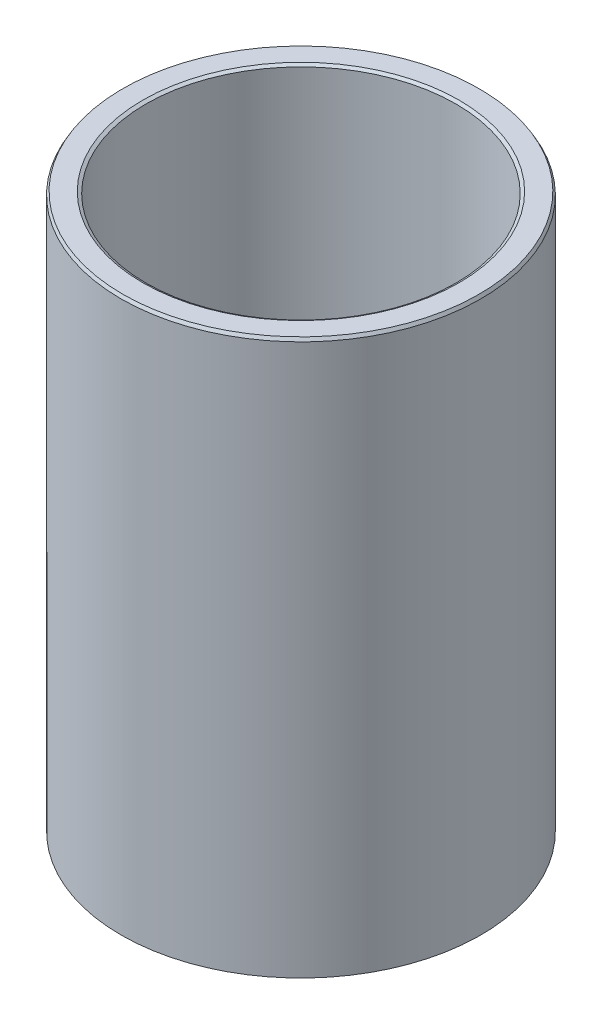
from build123d import *
from OCP.BRepFilletAPI import BRepFilletAPI_MakeChamfer

# Parameters (mm, degrees)
SKETCH1_R           = 42.5
BOSS_EXTRUDE1_DEPTH = 131.298463846
SKETCH2_R           = 36.633423213
CUT_EXTRUDE1_DEPTH  = 145.401477168
CHAMFER1_SIZE       = 0.730698724
CHAMFER1_SIZE2      = 0.421869105


with BuildPart() as part:
    # Sketch1 → Boss-Extrude1 (new body)
    with BuildSketch(Plane(origin=(0, 0, 0), x_dir=(1, 0, 0), z_dir=(0, 1, 0))):
        Circle(SKETCH1_R)
    extrude(amount=BOSS_EXTRUDE1_DEPTH)

    # Sketch2 → Cut-Extrude1 (cut, through all)
    with BuildSketch(Plane(origin=(0, 0, 0), x_dir=(1, 0, 0), z_dir=(0, 1, 0))):
        Circle(SKETCH2_R)
    extrude(amount=CUT_EXTRUDE1_DEPTH, mode=Mode.SUBTRACT)

    # Chamfer1: one chamfer whose edges measure the first distance from different faces: ONE call of the kernel's chamfer builder (chamfer() names one face for all edges)
    chamfer1_edges_1 = [part.edges().sort_by_distance(p)[0] for p in [
        (-36.633423213, 131.298463846, 0),
    ]]
    chamfer1_side_1 = [part.faces().sort_by_distance(p)[0] for p in [
        (-41.297918472, 131.298463846, 0),
    ]]
    chamfer1_edges_2 = [part.edges().sort_by_distance(p)[0] for p in [
        (-36.633423213, 0, 0),
    ]]
    chamfer1_side_2 = [part.faces().sort_by_distance(p)[0] for p in [
        (-36.633423213, 65.649231923, 0),
    ]]
    chamfer1_edges_3 = [part.edges().sort_by_distance(p)[0] for p in [
        (-42.5, 0, 0),
    ]]
    chamfer1_side_3 = [part.faces().sort_by_distance(p)[0] for p in [
        (-41.297918472, 0, 0),
    ]]
    chamfer1_edges_4 = [part.edges().sort_by_distance(p)[0] for p in [
        (-42.5, 131.298463846, 0),
    ]]
    chamfer1_side_4 = [part.faces().sort_by_distance(p)[0] for p in [
        (-42.5, 65.649231923, 0),
    ]]
    chamfer1 = BRepFilletAPI_MakeChamfer(part.part.solid().wrapped)
    for e in chamfer1_edges_1:
        chamfer1.Add(CHAMFER1_SIZE, CHAMFER1_SIZE2, e.wrapped, chamfer1_side_1[0].wrapped)  # the first distance lies on this face
    for e in chamfer1_edges_2:
        chamfer1.Add(CHAMFER1_SIZE, CHAMFER1_SIZE2, e.wrapped, chamfer1_side_2[0].wrapped)  # the first distance lies on this face
    for e in chamfer1_edges_3:
        chamfer1.Add(CHAMFER1_SIZE, CHAMFER1_SIZE2, e.wrapped, chamfer1_side_3[0].wrapped)  # the first distance lies on this face
    for e in chamfer1_edges_4:
        chamfer1.Add(CHAMFER1_SIZE, CHAMFER1_SIZE2, e.wrapped, chamfer1_side_4[0].wrapped)  # the first distance lies on this face
    add(Compound.cast(chamfer1.Shape()), mode=Mode.REPLACE)


solid = part.part
